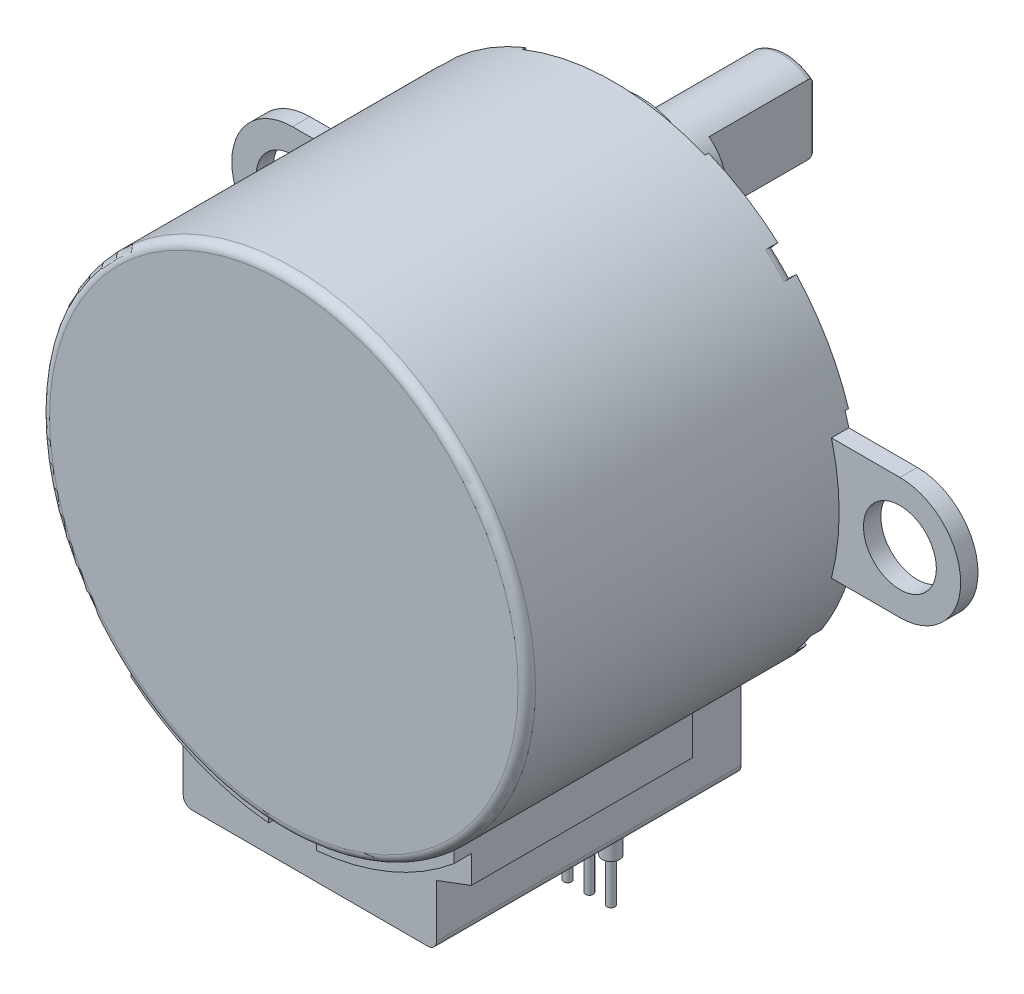
from build123d import *

# Parameters (mm, degrees)
SKETCH1_R            = 2.1
SKETCH1_R_2          = 14
BOSS_EXTRUDE1_DEPTH  = 1
SKETCH2_R            = 14
BOSS_EXTRUDE2_DEPTH  = 18
BOSS_EXTRUDE3_DEPTH  = 16.5
BOSS_EXTRUDE4_DEPTH  = 1
BOSS_EXTRUDE5_START  = -12.75
BOSS_EXTRUDE5_DEPTH  = 12.75
BOSS_EXTRUDE6_START  = 0.05
BOSS_EXTRUDE6_DEPTH  = 0.05
CUT_EXTRUDE1_DEPTH   = 5
SKETCH8_R            = 0.5
BOSS_EXTRUDE7_DEPTH  = 10
SKETCH9_R            = 0.225
BOSS_EXTRUDE8_DEPTH  = 2.5
SKETCH10_R           = 0.5
BOSS_EXTRUDE9_DEPTH  = 0.25
SKETCH11_R           = 4.5
SKETCH11_R_2         = 4
BOSS_EXTRUDE10_DEPTH = 1.5
SKETCH12_R           = 4
SKETCH12_R_2         = 2.525
BOSS_EXTRUDE11_DEPTH = 1.25
SKETCH13_R           = 2.5
BOSS_EXTRUDE12_DEPTH = 10
CUT_EXTRUDE2_START   = -6
CUT_EXTRUDE2_DEPTH   = 6
FILLET2_R            = 0.3
FILLET3_R            = 0.08
BOSS_EXTRUDE13_START = 0.2
BOSS_EXTRUDE13_DEPTH = 0.2
CUT_EXTRUDE3_DEPTH   = 0.5
REVOLVE1_ANGLE       = 6.141774
REVOLVE2_ANGLE       = 6.141774
REVOLVE3_ANGLE       = 6.141774
REVOLVE4_ANGLE       = 6.141774


with BuildPart() as part:
    # Sketch1 → Boss-Extrude1 (new body)
    # profile 1 of 4: a face of its own
    with BuildSketch(Plane.XY):
        with BuildLine():
            Line((-13.555441712, 3.5), (-17.5, 3.5))
            ThreePointArc((-17.5, 3.5), (-21, 0), (-17.5, -3.5))
            Line((-17.5, -3.5), (-13.555441712, -3.5))
            ThreePointArc((-13.555441712, -3.5), (-14, 0), (-13.555441712, 3.5))
        make_face()
        with Locations((-17.5, 0)):
            Circle(SKETCH1_R, mode=Mode.SUBTRACT)
    # profile 2 of 4: a face of its own
    with BuildSketch(Plane.XY):
        Circle(SKETCH1_R_2)
    # profile 3 of 4: a face of its own
    with BuildSketch(Plane.XY):
        with BuildLine():
            Line((17.5, 3.5), (13.555441712, 3.5))
            ThreePointArc((13.555441712, 3.5), (13.888415748, 1.764060095), (14, 0))
            ThreePointArc((14, 0), (13.888415748, -1.764060095), (13.555441712, -3.5))
            Line((13.555441712, -3.5), (17.5, -3.5))
            ThreePointArc((17.5, -3.5), (21, 0), (17.5, 3.5))
        make_face()
        with Locations((17.5, 0)):
            Circle(SKETCH1_R, mode=Mode.SUBTRACT)
    # profile 4 of 4: a face of its own
    with BuildSketch(Plane.XY):
        with BuildLine():
            ThreePointArc((7.3, -11.94612908), (0, -14), (-7.3, -11.94612908))
            Line((-7.3, -11.94612908), (-7.3, -16.5))
            ThreePointArc((-7.3, -16.5), (-7.153553391, -16.853553391), (-6.8, -17))
            Line((-6.8, -17), (6.8, -17))
            ThreePointArc((6.8, -17), (7.153553391, -16.853553391), (7.3, -16.5))
            Line((7.3, -16.5), (7.3, -11.94612908))
        make_face()
    extrude(amount=BOSS_EXTRUDE1_DEPTH)

    # Sketch2 → Boss-Extrude2 (add)
    with BuildSketch(Plane.XY.offset(1)):
        with Locations(Location((0, 0, 0), (0, 0, 165.522487814))):
            Circle(SKETCH2_R)
    extrude(amount=BOSS_EXTRUDE2_DEPTH)

    # Sketch3 → Boss-Extrude3 (add)
    with BuildSketch(Plane.XY.offset(1)):
        with BuildLine():
            Line((-7.3, -11.94612908), (-7.3, -16.5))
            ThreePointArc((-7.3, -16.5), (-7.153553391, -16.853553391), (-6.8, -17))
            Line((-6.8, -17), (6.8, -17))
            ThreePointArc((6.8, -17), (7.153553391, -16.853553391), (7.3, -16.5))
            Line((7.3, -16.5), (7.3, -11.94612908))
            ThreePointArc((7.3, -11.94612908), (0, -14), (-7.3, -11.94612908))
        make_face()
    extrude(amount=BOSS_EXTRUDE3_DEPTH)

    # Sketch4 → Boss-Extrude4 (add)
    with BuildSketch(Plane.XY.offset(17.5)):
        with BuildLine():
            Line((-1.375, -14.434658811), (-1.375, -13.932314058))
            ThreePointArc((-1.375, -13.932314058), (-4.449734705, -13.274029571), (-7.3, -11.94612908))
            Line((-7.3, -11.94612908), (-7.3, -12.528367811))
            ThreePointArc((-7.3, -12.528367811), (-4.440990047, -13.803173816), (-1.375, -14.434658811))
        make_face()
        with BuildLine():
            ThreePointArc((7.3, -11.94612908), (4.449734705, -13.274029571), (1.375, -13.932314058))
            Line((1.375, -13.932314058), (1.375, -14.434658811))
            ThreePointArc((1.375, -14.434658811), (4.440990047, -13.803173816), (7.3, -12.528367811))
            Line((7.3, -12.528367811), (7.3, -11.94612908))
        make_face()
        with BuildLine():
            Line((-7.3, -12.528367811), (-7.3, -11.94612908))
            ThreePointArc((-7.3, -11.94612908), (-8.332986027, -11.249948617), (-9.3, -10.464702576))
            Line((-9.3, -10.464702576), (-9.3, -11.124747188))
            ThreePointArc((-9.3, -11.124747188), (-8.329618101, -11.86875993), (-7.3, -12.528367811))
        make_face()
        with BuildLine():
            ThreePointArc((9.3, -10.464702576), (8.332986027, -11.249948617), (7.3, -11.94612908))
            Line((7.3, -11.94612908), (7.3, -12.528367811))
            ThreePointArc((7.3, -12.528367811), (8.329618101, -11.86875993), (9.3, -11.124747188))
            Line((9.3, -11.124747188), (9.3, -10.464702576))
        make_face()
    extrude(amount=BOSS_EXTRUDE4_DEPTH)

    # Sketch5 → Boss-Extrude5 (add)
    with BuildSketch(Plane.XY.offset(17.5).offset(BOSS_EXTRUDE5_START)):
        with BuildLine():
            Line((-9.3, -10.464702576), (-9.3, -12.714702576))
            Line((-9.3, -12.714702576), (-7.3, -13.464702576))
            Line((-7.3, -13.464702576), (-7.3, -12.528367811))
            Line((-7.3, -12.528367811), (-7.3, -11.94612908))
            ThreePointArc((-7.3, -11.94612908), (-8.332986027, -11.249948617), (-9.3, -10.464702576))
        make_face()
        with BuildLine():
            Line((9.3, -10.464702576), (9.3, -12.714702576))
            Line((9.3, -12.714702576), (7.3, -13.464702576))
            Line((7.3, -13.464702576), (7.3, -11.94612908))
            ThreePointArc((7.3, -11.94612908), (8.332986027, -11.249948617), (9.3, -10.464702576))
        make_face()
    extrude(amount=BOSS_EXTRUDE5_DEPTH)

    # Fillet1: read off the stored shape, not the designer's step
    # Fillet1 outline → Fillet1 (revolve, cut)
    with BuildSketch(Plane.XZ):
        with BuildLine():
            ThreePointArc((13.5, 19), (13.853553391, 18.853553391), (14, 18.5))
            Line((14, 18.5), (14, 19))
            Line((14, 19), (13.5, 19))
        make_face()
    revolve(axis=Axis((0, 0, 0), (0, 0, 1)), mode=Mode.SUBTRACT)

    # Sketch6 → Boss-Extrude6 (add)
    with BuildSketch(Plane(origin=(0, 0, 0), x_dir=(-1, 0, 0), z_dir=(0, 0, -1)).offset(BOSS_EXTRUDE6_START)):
        with BuildLine():
            Line((7.3, -11.94612908), (6.05, -11.94612908))
            Line((6.05, -11.94612908), (6.05, -15.25))
            Line((6.05, -15.25), (-6.05, -15.25))
            Line((-6.05, -15.25), (-6.05, -11.94612908))
            Line((-6.05, -11.94612908), (-7.3, -11.94612908))
            Line((-7.3, -11.94612908), (-7.3, -16.5))
            ThreePointArc((-7.3, -16.5), (-7.153553391, -16.853553391), (-6.8, -17))
            Line((-6.8, -17), (6.8, -17))
            ThreePointArc((6.8, -17), (7.153553391, -16.853553391), (7.3, -16.5))
            Line((7.3, -16.5), (7.3, -11.94612908))
        make_face()
    extrude(amount=-BOSS_EXTRUDE6_DEPTH)

    # Sketch7 → Cut-Extrude1 (cut)
    with BuildSketch(Plane.XZ.offset(17)):
        with BuildLine():
            Line((-3.5, 1.95), (3.5, 1.95))
            ThreePointArc((3.5, 1.95), (3.676776695, 2.023223305), (3.75, 2.2))
            Line((3.75, 2.2), (3.75, 3.1))
            ThreePointArc((3.75, 3.1), (3.676776695, 3.276776695), (3.5, 3.35))
            Line((3.5, 3.35), (-3.5, 3.35))
            ThreePointArc((-3.5, 3.35), (-3.676776695, 3.276776695), (-3.75, 3.1))
            Line((-3.75, 3.1), (-3.75, 2.2))
            ThreePointArc((-3.75, 2.2), (-3.676776695, 2.023223305), (-3.5, 1.95))
        make_face()
    extrude(amount=-CUT_EXTRUDE1_DEPTH, mode=Mode.SUBTRACT)

    # Sketch8 → Boss-Extrude7 (add)
    with BuildSketch(Plane.XZ.offset(12)):
        with Locations(Location((2.5, 2.65, 0), (0, 0, 180))):
            Circle(SKETCH8_R)
        with Locations(Location((1.25, 2.65, 0), (0, 0, 180))):
            Circle(SKETCH8_R)
        with Locations(Location((0, 2.65, 0), (0, 0, 180))):
            Circle(SKETCH8_R)
        with Locations(Location((-1.25, 2.65, 0), (0, 0, 180))):
            Circle(SKETCH8_R)
        with Locations(Location((-2.5, 2.65, 0), (0, 0, 180))):
            Circle(SKETCH8_R)
    extrude(amount=BOSS_EXTRUDE7_DEPTH)

    # Sketch9 → Boss-Extrude8 (add)
    with BuildSketch(Plane.XZ.offset(22)):
        with Locations((2.5, 2.65)):
            Circle(SKETCH9_R)
        with Locations((1.25, 2.65)):
            Circle(SKETCH9_R)
        with Locations((0, 2.65)):
            Circle(SKETCH9_R)
        with Locations((-1.25, 2.65)):
            Circle(SKETCH9_R)
        with Locations((-2.5, 2.65)):
            Circle(SKETCH9_R)
    extrude(amount=BOSS_EXTRUDE8_DEPTH)

    # Sketch10 → Boss-Extrude9 (add)
    with BuildSketch(Plane(origin=(0, 0, 0), x_dir=(-1, 0, 0), z_dir=(0, 0, -1))):
        with Locations(Location((5, 5.5, 0), (0, 0, 180))):
            Circle(SKETCH10_R)
        with Locations(Location((5.5, 0, 0), (0, 0, 180))):
            Circle(SKETCH10_R)
        with Locations(Location((0, 0.5, 0), (0, 0, 180))):
            Circle(SKETCH10_R)
        with Locations(Location((2.75, -4.25, 0), (0, 0, 180))):
            Circle(SKETCH10_R)
    extrude(amount=BOSS_EXTRUDE9_DEPTH)

    # Sketch11 → Boss-Extrude10 (add)
    with BuildSketch(Plane(origin=(0, 0, 0), x_dir=(-1, 0, 0), z_dir=(0, 0, -1))):
        with Locations(Location((0, 8, 0), (0, 0, 180))):
            Circle(SKETCH11_R)
        with Locations((0, 8)):
            Circle(SKETCH11_R_2, mode=Mode.SUBTRACT)
    extrude(amount=BOSS_EXTRUDE10_DEPTH)

    # Sketch12 → Boss-Extrude11 (add)
    with BuildSketch(Plane(origin=(0, 0, 0), x_dir=(-1, 0, 0), z_dir=(0, 0, -1))):
        with Locations((0, 8)):
            Circle(SKETCH12_R)
        with Locations((0, 8)):
            Circle(SKETCH12_R_2, mode=Mode.SUBTRACT)
    extrude(amount=BOSS_EXTRUDE11_DEPTH)

    # Sketch13 → Boss-Extrude12 (add)
    with BuildSketch(Plane(origin=(0, 0, 0), x_dir=(-1, 0, 0), z_dir=(0, 0, -1))):
        with Locations(Location((0, 8, 0), (0, 0, 180))):
            Circle(SKETCH13_R)
    extrude(amount=BOSS_EXTRUDE12_DEPTH)

    # Sketch14 → Cut-Extrude2 (cut)
    with BuildSketch(Plane(origin=(0, 0, -10), x_dir=(-1, 0, 0), z_dir=(0, 0, -1)).offset(CUT_EXTRUDE2_START)):
        with BuildLine():
            Line((-1.5, 6), (-1.5, 10))
            ThreePointArc((-1.5, 10), (-2.5, 8), (-1.5, 6))
        make_face()
        with BuildLine():
            ThreePointArc((2.5, 8), (2.236067977, 9.118033989), (1.5, 10))
            Line((1.5, 10), (1.5, 6))
            ThreePointArc((1.5, 6), (2.236067977, 6.881966011), (2.5, 8))
        make_face()
    extrude(amount=CUT_EXTRUDE2_DEPTH, mode=Mode.SUBTRACT)

    # Fillet2
    fillet2_edges = [part.edges().sort_by_distance(p)[0] for p in [
        (0, 10.5, -10),
        (0, 5.5, -10),
    ]]
    fillet(fillet2_edges, radius=FILLET2_R)

    # Fillet3
    # the kernel refuses this fillet: 0.08 mm, written as the material it takes off along each edge
    with BuildSketch(Plane(origin=(-1.5, 9.949347694, -10), x_dir=(0, 0, 1), z_dir=(0, -1, 0)), Plane(origin=(1.5, 6.050652306, -10), x_dir=(0, 0, 1), z_dir=(0, 1, 0))) as fillet3_piece_1:
        with BuildLine():
            CenterArc((FILLET3_R, -FILLET3_R), FILLET3_R, 90, 90)
            Line((0, -FILLET3_R), (0, 0))
            Line((0, 0), (FILLET3_R, 0))
        make_face()
    extrude(amount=3.898695388, mode=Mode.SUBTRACT)

    # Sketch15 → Boss-Extrude13 (add)
    with BuildSketch(Plane(origin=(0, 0, 0), x_dir=(-1, 0, 0), z_dir=(0, 0, -1)).offset(BOSS_EXTRUDE13_START)):
        with BuildLine():
            ThreePointArc((9.265464138, 10.49529296), (7.372289641, 11.901653055), (5.269909183, 12.970275911))
            Line((5.269909183, 12.970275911), (5.081698141, 12.507051771))
            ThreePointArc((5.081698141, 12.507051771), (7.108993582, 11.476594018), (8.934554704, 10.120461068))
            Line((8.934554704, 10.120461068), (9.265464138, 10.49529296))
        make_face()
        with BuildLine():
            ThreePointArc((13.339321572, 4.25), (12.118748501, 7.009702902), (10.335163186, 9.443749358))
            Line((10.335163186, 9.443749358), (9.966050215, 9.106472595))
            ThreePointArc((9.966050215, 9.106472595), (11.685936055, 6.759356369), (12.86291723, 4.098214286))
            Line((12.86291723, 4.098214286), (13.339321572, 4.25))
        make_face()
        with BuildLine():
            Line((11.366412594, -7.283863312), (11.787390838, -7.553636027))
            ThreePointArc((11.787390838, -7.553636027), (12.671480651, -5.952611033), (13.339321572, -4.25))
            Line((13.339321572, -4.25), (12.86291723, -4.098214286))
            ThreePointArc((12.86291723, -4.098214286), (12.218927771, -5.740017782), (11.366412594, -7.283863312))
        make_face()
        with BuildLine():
            ThreePointArc((10.521878438, -8.458136564), (9.503542294, -9.588153309), (8.364543943, -10.59643358))
            Line((8.364543943, -10.59643358), (8.674341867, -10.988894083))
            ThreePointArc((8.674341867, -10.988894083), (9.855525341, -9.943270098), (10.911577639, -8.771400881))
            Line((10.911577639, -8.771400881), (10.521878438, -8.458136564))
        make_face()
        with BuildLine():
            Line((-10.521878438, -8.458136564), (-10.911577639, -8.771400881))
            ThreePointArc((-10.911577639, -8.771400881), (-9.855525341, -9.943270098), (-8.674341867, -10.988894083))
            Line((-8.674341867, -10.988894083), (-8.364543943, -10.59643358))
            ThreePointArc((-8.364543943, -10.59643358), (-9.503542294, -9.588153309), (-10.521878438, -8.458136564))
        make_face()
        with BuildLine():
            ThreePointArc((-11.366412594, -7.283863312), (-12.218927771, -5.740017782), (-12.86291723, -4.098214286))
            Line((-12.86291723, -4.098214286), (-13.339321572, -4.25))
            ThreePointArc((-13.339321572, -4.25), (-12.671480651, -5.952611033), (-11.787390838, -7.553636027))
            Line((-11.787390838, -7.553636027), (-11.366412594, -7.283863312))
        make_face()
        with BuildLine():
            Line((-9.966050215, 9.106472595), (-10.335163186, 9.443749358))
            ThreePointArc((-10.335163186, 9.443749358), (-12.118748501, 7.009702902), (-13.339321572, 4.25))
            Line((-13.339321572, 4.25), (-12.86291723, 4.098214286))
            ThreePointArc((-12.86291723, 4.098214286), (-11.685936055, 6.759356369), (-9.966050215, 9.106472595))
        make_face()
        with BuildLine():
            ThreePointArc((-5.269909183, 12.970275911), (-7.372289641, 11.901653055), (-9.265464138, 10.49529296))
            Line((-9.265464138, 10.49529296), (-8.934554704, 10.120461068))
            ThreePointArc((-8.934554704, 10.120461068), (-7.108993582, 11.476594018), (-5.081698141, 12.507051771))
            Line((-5.081698141, 12.507051771), (-5.269909183, 12.970275911))
        make_face()
    extrude(amount=-BOSS_EXTRUDE13_DEPTH)

    # Sketch16 → Cut-Extrude3 (cut)
    with BuildSketch(Plane(origin=(0, 0, 0), x_dir=(-1, 0, 0), z_dir=(0, 0, -1))):
        with BuildLine():
            Line((-8.412348817, 8.557592382), (-9.46389242, 9.62729143))
            ThreePointArc((-9.46389242, 9.62729143), (-9.718460822, 9.370246488), (-9.966050215, 9.106472595))
            ThreePointArc((-9.966050215, 9.106472595), (-10.224781926, 8.814977854), (-10.474990951, 8.516135543))
            Line((-10.474990951, 8.516135543), (-9.482047865, 7.50604878))
            Line((-9.482047865, 7.50604878), (-8.412348817, 8.557592382))
        make_face()
        with BuildLine():
            ThreePointArc((-8.934554704, 10.120461068), (-9.202527817, 9.877422831), (-9.46389242, 9.62729143))
            Line((-9.46389242, 9.62729143), (-8.412348817, 8.557592382))
            Line((-8.412348817, 8.557592382), (-7.34264977, 9.609135984))
            Line((-7.34264977, 9.609135984), (-8.335592855, 10.619222747))
            ThreePointArc((-8.335592855, 10.619222747), (-8.638674087, 10.374165509), (-8.934554704, 10.120461068))
        make_face()
        with BuildLine():
            Line((-10.617932034, -5.788740737), (-11.852931436, -6.462044288))
            ThreePointArc((-11.852931436, -6.462044288), (-11.616941548, -6.877257381), (-11.366412594, -7.283863312))
            Line((-11.366412594, -7.283863312), (-11.787390838, -7.553636027))
            ThreePointArc((-11.787390838, -7.553636027), (-11.580756253, -7.866770913), (-11.365805308, -8.174256523))
            Line((-11.365805308, -8.174256523), (-10.95988369, -7.88231879))
            Line((-10.95988369, -7.88231879), (-9.742118835, -7.006505591))
            Line((-9.742118835, -7.006505591), (-10.617932034, -5.788740737))
        make_face()
        with BuildLine():
            Line((-8.866305636, -8.224270445), (-9.742118835, -7.006505591))
            Line((-9.742118835, -7.006505591), (-10.95988369, -7.88231879))
            Line((-10.95988369, -7.88231879), (-11.365805308, -8.174256523))
            ThreePointArc((-11.365805308, -8.174256523), (-11.142692363, -8.475872044), (-10.911577639, -8.771400881))
            Line((-10.911577639, -8.771400881), (-10.521878438, -8.458136564))
            ThreePointArc((-10.521878438, -8.458136564), (-10.216116556, -8.825019122), (-9.897568798, -9.180856817))
            Line((-9.897568798, -9.180856817), (-8.866305636, -8.224270445))
        make_face()
        with BuildLine():
            Line((10.95988369, -7.88231879), (9.742118835, -7.006505591))
            Line((9.742118835, -7.006505591), (8.866305636, -8.224270445))
            Line((8.866305636, -8.224270445), (9.897568798, -9.180856817))
            ThreePointArc((9.897568798, -9.180856817), (10.216116556, -8.825019122), (10.521878438, -8.458136564))
            Line((10.521878438, -8.458136564), (10.911577639, -8.771400881))
            ThreePointArc((10.911577639, -8.771400881), (11.142692363, -8.475872044), (11.365805308, -8.174256523))
            Line((11.365805308, -8.174256523), (10.95988369, -7.88231879))
        make_face()
        with BuildLine():
            ThreePointArc((11.366412594, -7.283863312), (11.616941548, -6.877257381), (11.852931436, -6.462044288))
            Line((11.852931436, -6.462044288), (10.617932034, -5.788740737))
            Line((10.617932034, -5.788740737), (9.742118835, -7.006505591))
            Line((9.742118835, -7.006505591), (10.95988369, -7.88231879))
            Line((10.95988369, -7.88231879), (11.365805308, -8.174256523))
            ThreePointArc((11.365805308, -8.174256523), (11.580756253, -7.866770913), (11.787390838, -7.553636027))
            Line((11.787390838, -7.553636027), (11.366412594, -7.283863312))
        make_face()
        with BuildLine():
            ThreePointArc((8.934554704, 10.120461068), (8.638674087, 10.374165509), (8.335592855, 10.619222747))
            Line((8.335592855, 10.619222747), (7.34264977, 9.609135984))
            Line((7.34264977, 9.609135984), (8.412348817, 8.557592382))
            Line((8.412348817, 8.557592382), (9.46389242, 9.62729143))
            Line((9.46389242, 9.62729143), (9.814406954, 9.983857779))
            ThreePointArc((9.814406954, 9.983857779), (9.54336218, 10.243253306), (9.265464138, 10.49529296))
            Line((9.265464138, 10.49529296), (8.934554704, 10.120461068))
        make_face()
        with BuildLine():
            Line((9.46389242, 9.62729143), (8.412348817, 8.557592382))
            Line((8.412348817, 8.557592382), (9.482047865, 7.50604878))
            Line((9.482047865, 7.50604878), (10.522778953, 8.457016206))
            ThreePointArc((10.522778953, 8.457016206), (10.24955992, 8.7861551), (9.966050215, 9.106472595))
            Line((9.966050215, 9.106472595), (10.335163186, 9.443749358))
            ThreePointArc((10.335163186, 9.443749358), (10.078403816, 9.717292654), (9.814406954, 9.983857779))
            Line((9.814406954, 9.983857779), (9.46389242, 9.62729143))
        make_face()
        with BuildLine():
            ThreePointArc((-9.966050215, 9.106472595), (-9.718460822, 9.370246488), (-9.46389242, 9.62729143))
            Line((-9.46389242, 9.62729143), (-9.814406954, 9.983857779))
            ThreePointArc((-9.814406954, 9.983857779), (-10.078403816, 9.717292654), (-10.335163186, 9.443749358))
            Line((-10.335163186, 9.443749358), (-9.966050215, 9.106472595))
        make_face()
        with BuildLine():
            Line((-9.814406954, 9.983857779), (-9.46389242, 9.62729143))
            ThreePointArc((-9.46389242, 9.62729143), (-9.202527817, 9.877422831), (-8.934554704, 10.120461068))
            Line((-8.934554704, 10.120461068), (-9.265464138, 10.49529296))
            ThreePointArc((-9.265464138, 10.49529296), (-9.54336218, 10.243253306), (-9.814406954, 9.983857779))
        make_face()
    extrude(amount=-CUT_EXTRUDE3_DEPTH, mode=Mode.SUBTRACT)

    # Revolve1: read off the stored shape, not the designer's step
    # Revolve1 outline → Revolve1 (revolve)
    with BuildSketch(Plane(origin=(0, 0, 0), x_dir=(0.7382259418231817, 0.6745535255406173, 0), z_dir=(0.6745535255406173, -0.7382259418231817, 0))):
        with BuildLine():
            Line((13, 0.5), (13.2, 0))
            Line((13.2, 0), (13.5, 0))
            ThreePointArc((13.5, 0), (13.853553391, 0.146446609), (14, 0.5))
            Line((14, 0.5), (13, 0.5))
        make_face()
    revolve(axis=Axis((0, 0, 0), (0, 0, 1)), revolution_arc=REVOLVE1_ANGLE)

    # Revolve2: read off the stored shape, not the designer's step
    # Revolve2 outline → Revolve2 (revolve)
    with BuildSketch(Plane(origin=(0, 0, 0), x_dir=(0.779398402812933, -0.6265286343756756, 0), z_dir=(-0.6265286343756756, -0.779398402812933, 0))):
        with BuildLine():
            Line((13, 0.5), (13.2, 0))
            Line((13.2, 0), (13.5, 0))
            ThreePointArc((13.5, 0), (13.853553391, 0.146446609), (14, 0.5))
            Line((14, 0.5), (13, 0.5))
        make_face()
    revolve(axis=Axis((0, 0, 0), (0, 0, 1)), revolution_arc=REVOLVE2_ANGLE)

    # Revolve3: read off the stored shape, not the designer's step
    # Revolve3 outline → Revolve3 (revolve)
    with BuildSketch(Plane(origin=(0, 0, 0), x_dir=(-0.6618188669858526, 0.7496637828397223, 0), z_dir=(0.7496637828397223, 0.6618188669858526, 0))):
        with BuildLine():
            Line((13, 0.5), (13.2, 0))
            Line((13.2, 0), (13.5, 0))
            ThreePointArc((13.5, 0), (13.853553391, 0.146446609), (14, 0.5))
            Line((14, 0.5), (13, 0.5))
        make_face()
    revolve(axis=Axis((0, 0, 0), (0, 0, 1)), revolution_arc=REVOLVE3_ANGLE)

    # Revolve4: read off the stored shape, not the designer's step
    # Revolve4 outline → Revolve4 (revolve)
    with BuildSketch(Plane(origin=(0, 0, 0), x_dir=(-0.8419564884475546, -0.539545430488539, 0), z_dir=(-0.539545430488539, 0.8419564884475546, 0))):
        with BuildLine():
            Line((13, 0.5), (13.2, 0))
            Line((13.2, 0), (13.5, 0))
            ThreePointArc((13.5, 0), (13.853553391, 0.146446609), (14, 0.5))
            Line((14, 0.5), (13, 0.5))
        make_face()
    revolve(axis=Axis((0, 0, 0), (0, 0, 1)), revolution_arc=REVOLVE4_ANGLE)


solid = part.part
